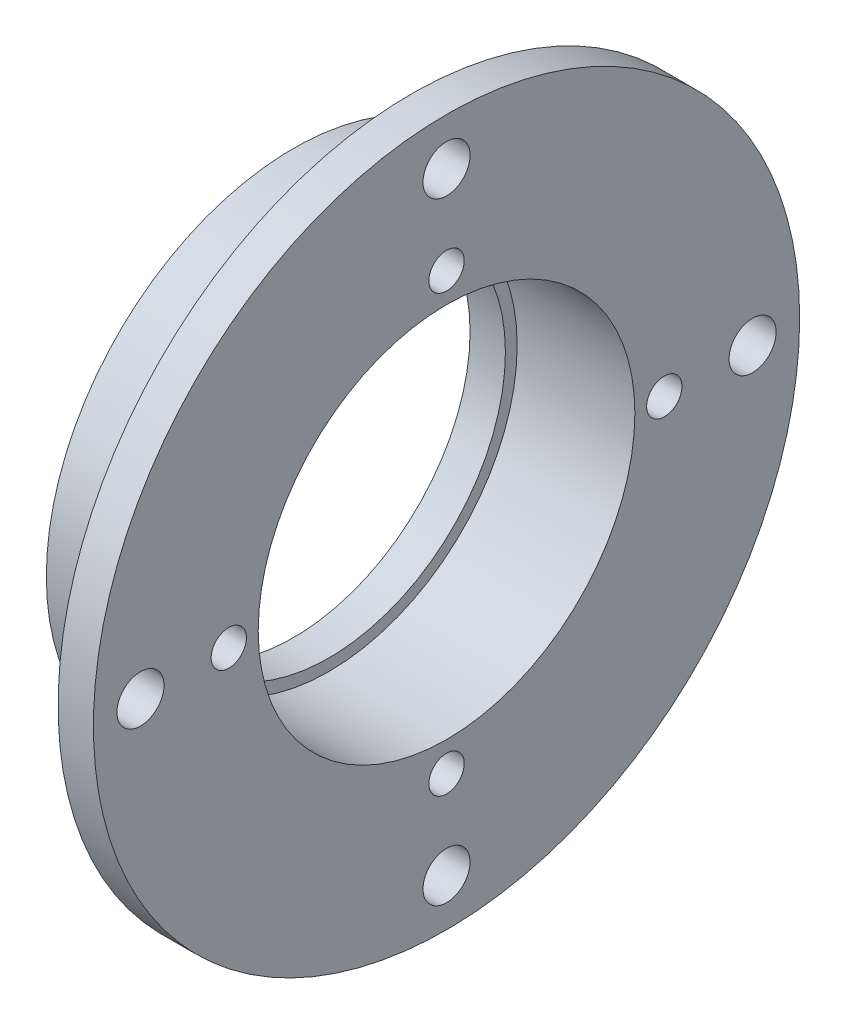
from build123d import *

# Parameters (mm, degrees)
SKETCH8_R           = 21
SKETCH8_R_2         = 16
BOSS_EXTRUDE4_DEPTH = 7
BOSS_EXTRUDE5_START = 3
SKETCH9_R           = 21
SKETCH9_R_2         = 15
BOSS_EXTRUDE5_DEPTH = 3
SKETCH10_R          = 30
SKETCH10_R_2        = 16
BOSS_EXTRUDE6_DEPTH = 3
SKETCH11_R          = 1.5
SKETCH11_R_2        = 2
CUT_EXTRUDE4_DEPTH  = 6


with BuildPart() as part:
    # Sketch8 → Boss-Extrude4 (new body)
    with BuildSketch(Plane(origin=(0, 0, 0), x_dir=(0, 0, -1), z_dir=(1, 0, 0))):
        Circle(SKETCH8_R)
        Circle(SKETCH8_R_2, mode=Mode.SUBTRACT)
    extrude(amount=BOSS_EXTRUDE4_DEPTH)

    # Sketch9 → Boss-Extrude5 (add)
    with BuildSketch(Plane.ZY.offset(BOSS_EXTRUDE5_START)):
        Circle(SKETCH9_R)
        Circle(SKETCH9_R_2, mode=Mode.SUBTRACT)
    extrude(amount=-BOSS_EXTRUDE5_DEPTH)

    # Sketch10 → Boss-Extrude6 (add)
    with BuildSketch(Plane(origin=(7, 0, 0), x_dir=(0, 0, -1), z_dir=(1, 0, 0))):
        Circle(SKETCH10_R)
        Circle(SKETCH10_R_2, mode=Mode.SUBTRACT)
    extrude(amount=BOSS_EXTRUDE6_DEPTH)

    # Sketch11 → Cut-Extrude4 (cut)
    with BuildSketch(Plane(origin=(10, 0, 0), x_dir=(0, 0, -1), z_dir=(1, 0, 0))):
        with Locations((0, 18.5)):
            Circle(SKETCH11_R)
        with Locations((0, 26)):
            Circle(SKETCH11_R_2)
        with Locations((26, 0)):
            Circle(SKETCH11_R_2)
        with Locations((18.5, 0)):
            Circle(SKETCH11_R)
        with Locations((0, -26)):
            Circle(SKETCH11_R_2)
        with Locations((0, -18.5)):
            Circle(SKETCH11_R)
        with Locations((-26, 0)):
            Circle(SKETCH11_R_2)
        with Locations((-18.5, 0)):
            Circle(SKETCH11_R)
    extrude(amount=-CUT_EXTRUDE4_DEPTH, mode=Mode.SUBTRACT)


solid = part.part
